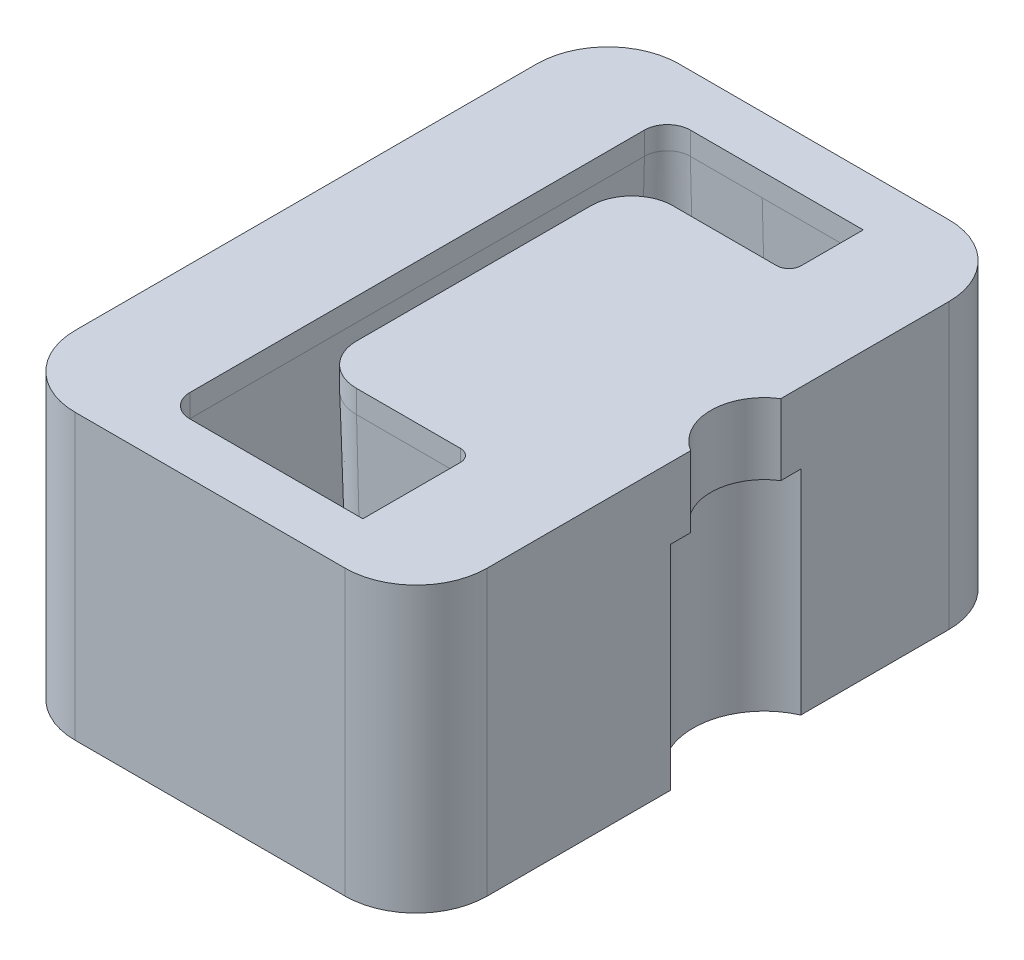
from build123d import *

# Parameters (mm, degrees)
SKETCH1_W                   = 58
SKETCH1_H                   = 85
BOSS_EXTRUDE1_DEPTH         = 40
FILLET1_R                   = 10
CUT_EXTRUDE1_REACH          = 67.171
M6_TAPPED_HOLE1_D           = 5
M6_TAPPED_HOLE1_DEPTH       = 17
M6_TAPPED_HOLE1_CSINK_D     = 6.05
M6_TAPPED_HOLE1_CSINK_ANGLE = 90
M6_TAPPED_HOLE1_TIP         = 1.502151548
SKETCH9_R                   = 7.5
CUT_EXTRUDE2_DEPTH          = 333.145792236
SKETCH10_R                  = 10
CUT_EXTRUDE3_DEPTH          = 30


with BuildPart() as part:
    # Sketch1 → Boss-Extrude1 (new body)
    with BuildSketch(Plane(origin=(0, 0, 0), x_dir=(1, 0, 0), z_dir=(0, 1, 0))):
        Rectangle(SKETCH1_W, SKETCH1_H)
    extrude(amount=-BOSS_EXTRUDE1_DEPTH)

    # Fillet1
    fillet1_edges = [part.edges().sort_by_distance(p)[0] for p in [
        (-29, -20, -42.5),
        (29, -20, -42.5),
        (29, -20, 42.5),
        (-29, -20, 42.5),
    ]]
    fillet(fillet1_edges, radius=FILLET1_R)

    # Sketch2 → Cut-Extrude1 (cut, up to next)
    with BuildSketch(Plane(origin=(0, 0, 0), x_dir=(1, 0, 0), z_dir=(0, 1, 0)), mode=Mode.PRIVATE) as cut_extrude1_sk1:
        with BuildLine():
            Line((14.23, 35.23), (-10.12, 35.23))
            ThreePointArc((-10.12, 35.23), (-12.403954903, 34.283954903), (-13.35, 32))
            Line((-13.35, 32), (-13.35, -32))
            ThreePointArc((-13.35, -32), (-12.403954903, -34.283954903), (-10.12, -35.23))
            Line((-10.12, -35.23), (14.23, -35.23))
            Line((14.23, -35.23), (14.23, -21.5))
            ThreePointArc((14.23, -21.5), (13.723294731, -20.276705269), (12.5, -19.77))
            Line((12.5, -19.77), (-2.12, -19.77))
            ThreePointArc((-2.12, -19.77), (-6.200006127, -18.080006127), (-7.89, -14))
            Line((-7.89, -14), (-7.89, 19))
            ThreePointArc((-7.89, 19), (-6.200006127, 23.080006127), (-2.12, 24.77))
            Line((-2.12, 24.77), (12.5, 24.77))
            ThreePointArc((12.5, 24.77), (13.723294731, 25.276705269), (14.23, 26.5))
            Line((14.23, 26.5), (14.23, 35.23))
        make_face()
    cut_extrude1_tool1 = extrude(cut_extrude1_sk1.sketch, amount=-CUT_EXTRUDE1_REACH, mode=Mode.PRIVATE) & part.part
    add(cut_extrude1_tool1.solids().sort_by_distance((-8.646655, 0, -2.5))[0], mode=Mode.SUBTRACT)

    # Cut-Sweep1: sweep along a path in Sketch5
    with BuildLine(Plane(origin=(0, 0, 0), x_dir=(1, 0, 0), z_dir=(0, 1, 0))) as cut_sweep1_path:
        Line((12.5, -19.77), (-2.12, -19.77))
        ThreePointArc((-2.12, -19.77), (-6.200006127, -18.080006127), (-7.89, -14))
        Line((-7.89, -14), (-7.89, 19))
        ThreePointArc((-7.89, 19), (-6.200006127, 23.080006127), (-2.12, 24.77))
        Line((-2.12, 24.77), (12.5, 24.77))
        ThreePointArc((12.5, 24.77), (13.723294731, 25.276705269), (14.23, 26.5))
        Line((14.23, 26.5), (14.23, 35.23))
        Line((14.23, 35.23), (-10.12, 35.23))
        ThreePointArc((-10.12, 35.23), (-12.403954903, 34.283954903), (-13.35, 32))
        Line((-13.35, 32), (-13.35, -32))
        ThreePointArc((-13.35, -32), (-12.403954903, -34.283954903), (-10.12, -35.23))
        Line((-10.12, -35.23), (14.23, -35.23))
        Line((14.23, -35.23), (14.23, -21.5))
        ThreePointArc((14.23, -21.5), (13.723294731, -20.276705269), (12.5, -19.77))
    # Sketch3 → Cut-Sweep1 (sweep, cut)
    with BuildSketch(Plane(origin=(0, 0, 0), x_dir=(0, 0, -1), z_dir=(1, 0, 0))):
        Polygon((35.23, -3.2), (36.193641914, -40), (35.23, -40), align=None)
    sweep(path=cut_sweep1_path.line, transition=Transition.RIGHT, mode=Mode.SUBTRACT)

    # M6 Tapped Hole1
    with Locations(Plane(origin=(0, -40, 0), x_dir=(-1, 0, 0), z_dir=(0, -1, 0))):
        with Locations((-22, 35.5), (22, 35.5), (22, -35.5), (-22, -35.5)):
            CounterSinkHole(M6_TAPPED_HOLE1_D / 2, M6_TAPPED_HOLE1_CSINK_D / 2, depth=M6_TAPPED_HOLE1_DEPTH, counter_sink_angle=M6_TAPPED_HOLE1_CSINK_ANGLE)
            with Locations((0, 0, -(M6_TAPPED_HOLE1_DEPTH + M6_TAPPED_HOLE1_TIP / 2))):  # 118° drill point
                Cone(0, M6_TAPPED_HOLE1_D / 2, M6_TAPPED_HOLE1_TIP, mode=Mode.SUBTRACT)

    # Sketch9 → Cut-Extrude2 (cut, through all)
    with BuildSketch(Plane(origin=(296.88, 0, 7.73), x_dir=(1, 0, 0), z_dir=(0, 1, 0))):
        with Locations((-263.88, 10.23)):
            Circle(SKETCH9_R)
    extrude(amount=-CUT_EXTRUDE2_DEPTH, mode=Mode.SUBTRACT)

    # Sketch10 → Cut-Extrude3 (cut)
    with BuildSketch(Plane(origin=(296.88, -40, 7.73), x_dir=(1, 0, 0), z_dir=(0, -1, 0))):
        with Locations((-263.88, -10.23)):
            Circle(SKETCH10_R)
    extrude(amount=-CUT_EXTRUDE3_DEPTH, mode=Mode.SUBTRACT)


solid = part.part
